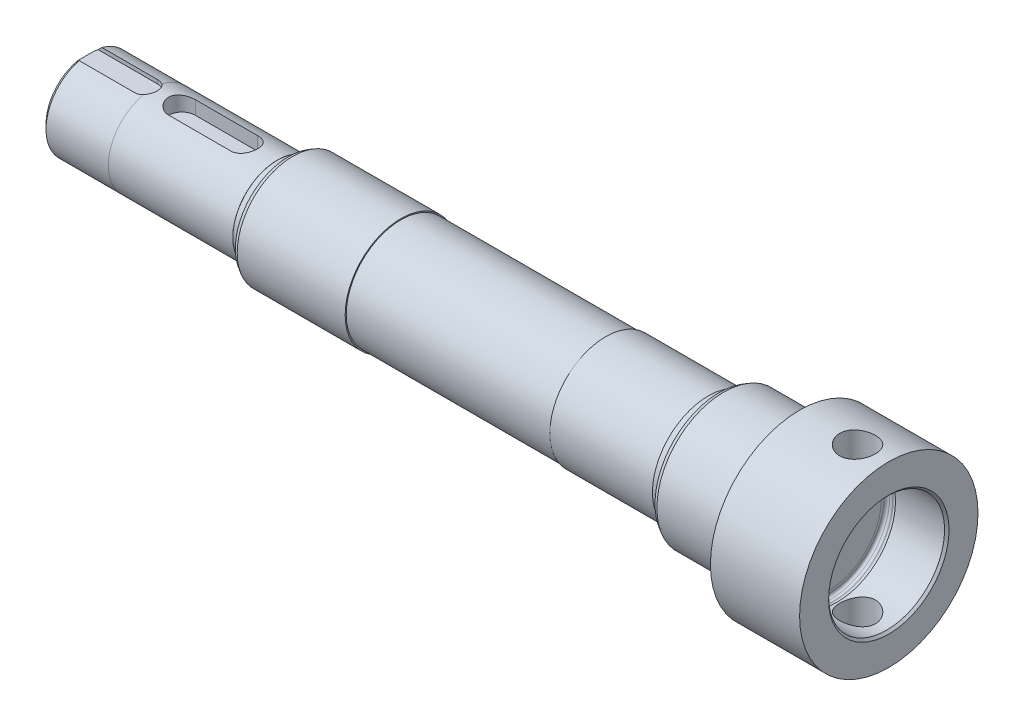
from build123d import *
from OCP.BRepFilletAPI import BRepFilletAPI_MakeChamfer

# Parameters (mm, degrees)
FASE1_SIZE                      = 1
SKIZZE3_R                       = 4
SCHNITT_LINEAR_AUSTRAGEN2_DEPTH = 22.5
SCHNITT_LINEAR_AUSTRAGEN3_DEPTH = 3.5
SCHNITT_LINEAR_AUSTRAGEN4_DEPTH = 1.2
FASE2_SIZE                      = 1
FASE2_SIZE2                     = 0.577350269
SCHNITT_F_T2_DEPTH              = 2
SCHNITT_F_T2_DEPTH_BACK         = 0.1
G_T1_R                          = 13.2
G_T1_R_2                        = 11.8
FASE_15_T1_SIZE2                = 0.746410162
FASE_15_T1_SIZE                 = 0.2
FASE_8_T2_SIZE                  = 0.711536972
FASE_8_T2_SIZE_2                = 0.1
RADIUS_R_R                      = 0.6
SCHNITT_F_T21_DEPTH             = 2.5
SCHNITT_F_T21_DEPTH_BACK        = 0.2
G_T11_R                         = 11.775
G_T11_R_2                       = 9.675
FASE_8_T21_SIZE2                = 1.423073944
FASE_8_T21_SIZE                 = 0.2
RADIUS_R1_R                     = 0.6
SCHNITT_F_T22_DEPTH             = 2.5
SCHNITT_F_T22_DEPTH_BACK        = 0.2
G_T12_R                         = 14.3
G_T12_R_2                       = 12.2
FASE_8_T22_SIZE                 = 1.423073944
FASE_8_T22_SIZE_2               = 0.2
RADIUS_R2_R                     = 0.6


with BuildPart() as part:
    # Skizze1 → Rotation1 (revolve)
    with BuildSketch(Plane.XY, mode=Mode.PRIVATE) as rotation1_sk:
        with BuildLine():
            Line((-180, 0), (-180, 9.975))
            Line((-180, 9.975), (-165, 9.975))
            Line((-165, 9.975), (-165, 10))
            Line((-165, 10), (-134.6, 10))
            Line((-134.6, 10), (-134.6, 12.5))
            Line((-134.6, 12.5), (-109.4, 12.5))
            Line((-109.4, 12.5), (-109.4, 12.25))
            Line((-109.4, 12.25), (-63.5, 12.25))
            Line((-63.5, 12.25), (-63.5, 12.5))
            Line((-63.5, 12.5), (-38, 12.5))
            Line((-38, 12.5), (-38, 15))
            Line((-38, 15), (-22.01, 15))
            Line((-22.01, 15), (-22.01, 14.99))
            Line((-22.01, 14.99), (-22, 14.99))
            Line((-22, 14.99), (-22, 15))
            ThreePointArc((-22, 15), (-20.585786438, 15.585786438), (-20, 17))
            Line((-20, 17), (-20, 20))
            Line((-20, 20), (0, 20))
            Line((0, 20), (0, 13.5))
            Line((0, 13.5), (-0.5, 13))
            Line((-0.5, 13), (-13.5, 13))
            Line((-13.5, 13), (-13.5, 0))
            Line((-13.5, 0), (-180, 0))
        make_face()
    revolve(rotation1_sk.sketch.rotate(Axis((-239.063776618, 0, 0), (1, 0, 0)), 90), axis=Axis((-239.063776618, 0, 0), (1, 0, 0)))

    # Fase1
    fase1_edges = [part.edges().sort_by_distance(p)[0] for p in [
        (-180, 0, -9.975),
    ]]
    chamfer(fase1_edges, length=FASE1_SIZE)

    # Skizze3 → Schnitt-Linear austragen2 (cut, symmetric)
    with BuildSketch(Plane(origin=(0, 0, 0), x_dir=(1, 0, 0), z_dir=(0, 1, 0))):
        with Locations(Location((-7, 0, 0), (0, 0, 270))):
            Circle(SKIZZE3_R)
    extrude(amount=SCHNITT_LINEAR_AUSTRAGEN2_DEPTH, both=True, mode=Mode.SUBTRACT)

    # Skizze6 → Schnitt-Linear austragen3 (cut)
    with BuildSketch(Plane(origin=(0, 10, 0), x_dir=(-1, 0, 0), z_dir=(0, 1, 0))):
        with BuildLine():
            Line((144.5, 3), (158.5, 3))
            ThreePointArc((158.5, 3), (161.5, 0), (158.5, -3))
            Line((158.5, -3), (144.5, -3))
            ThreePointArc((144.5, -3), (141.5, 0), (144.5, 3))
        make_face()
    extrude(amount=-SCHNITT_LINEAR_AUSTRAGEN3_DEPTH, mode=Mode.SUBTRACT)

    # Skizze7 → Schnitt-Linear austragen4 (cut)
    with BuildSketch(Plane(origin=(0, 10, 0), x_dir=(-1, 0, 0), z_dir=(0, 1, 0))):
        with BuildLine():
            Line((180, -2.55), (166.55, -2.55))
            ThreePointArc((166.55, -2.55), (164, 0), (166.55, 2.55))
            Line((166.55, 2.55), (180, 2.55))
            ThreePointArc((180, 2.55), (182.55, 0), (180, -2.55))
        make_face()
    extrude(amount=-SCHNITT_LINEAR_AUSTRAGEN4_DEPTH, mode=Mode.SUBTRACT)

    # Fase2: one chamfer whose edges measure the first distance from different faces: ONE call of the kernel's chamfer builder (chamfer() names one face for all edges)
    fase2_edges_1 = [part.edges().sort_by_distance(p)[0] for p in [
        (-134.6, 0, -12.5),
    ]]
    fase2_side_1 = [part.faces().sort_by_distance(p)[0] for p in [
        (-122, 0, -12.5),
    ]]
    fase2_edges_2 = [part.edges().sort_by_distance(p)[0] for p in [
        (-38, 0, -15),
    ]]
    fase2_side_2 = [part.faces().sort_by_distance(p)[0] for p in [
        (-30.005, 0, -15),
    ]]
    fase2 = BRepFilletAPI_MakeChamfer(part.part.solid().wrapped)
    for e in fase2_edges_1:
        fase2.Add(FASE2_SIZE, FASE2_SIZE2, e.wrapped, fase2_side_1[0].wrapped)  # the first distance lies on this face
    for e in fase2_edges_2:
        fase2.Add(FASE2_SIZE, FASE2_SIZE2, e.wrapped, fase2_side_2[0].wrapped)  # the first distance lies on this face
    add(Compound.cast(fase2.Shape()), mode=Mode.REPLACE)

    # Skizze31 → Schnitt-Rotation1 (revolve, cut)
    with BuildSketch(Plane(origin=(-180, 0, 0), x_dir=(0, 0, 1), z_dir=(0, -1, 0)), mode=Mode.PRIVATE) as schnitt_rotation1_sk:
        Polygon((0, -2.20043031), (0.5, -1.9), (0.5, -0.969948452), (1.06, 0), (0, 0), align=None)
    revolve(schnitt_rotation1_sk.sketch.rotate(Axis((-180, 0, 0), (1, 0, 0)), 90), axis=Axis((-180, 0, 0), (1, 0, 0)), mode=Mode.SUBTRACT)

    # Skizze32 → Schnitt-Rotation11 (revolve, cut)
    with BuildSketch(Plane(origin=(-13.5, 0, 0), x_dir=(0, 0, -1), z_dir=(0, -1, 0)), mode=Mode.PRIVATE) as schnitt_rotation11_sk:
        Polygon((0, -2.20043031), (0.5, -1.9), (0.5, -0.969948452), (1.06, 0), (0, 0), align=None)
    revolve(schnitt_rotation11_sk.sketch.rotate(Axis((-13.5, 0, 0), (-1, 0, 0)), 270), axis=Axis((-13.5, 0, 0), (-1, 0, 0)), mode=Mode.SUBTRACT)

    # g+t1 → Schnitt f+t2 (cut, two sides: drawn at the far end of the back side and taken through both)
    with BuildSketch(Plane(origin=(-13.5, -18.258316634, 5.175605519), x_dir=(0, 0, -1), z_dir=(1, 0, 0)).offset(-SCHNITT_F_T2_DEPTH_BACK)):
        with Locations((5.175605519, 18.258316634)):
            Circle(G_T1_R)
        with Locations(Location((5.175605519, 18.258316634, 0), (0, 0, 180))):
            Circle(G_T1_R_2, mode=Mode.SUBTRACT)
    extrude(amount=SCHNITT_F_T2_DEPTH + SCHNITT_F_T2_DEPTH_BACK, mode=Mode.SUBTRACT)

    # Fase 15° t1
    fase_15_t1_edges = [part.edges().sort_by_distance(p)[0] for p in [
        (-11.5, 0, 13.2),
    ]]
    fase_15_t1_side = [part.faces().sort_by_distance(p)[0] for p in [
        (-11.5, 0, 13.196),
    ]]
    chamfer(fase_15_t1_edges, length=FASE_15_T1_SIZE - 0.0001, length2=FASE_15_T1_SIZE2 - 0.0001, reference=fase_15_t1_side[0])  # a hair under: the kernel refuses the full size

    # Fase 8° t2
    # the kernel refuses this chamfer: 0.711536972, 0.1 mm, written as the material it adds along each edge
    with BuildSketch(Plane(origin=(-13.6, 0, 0), x_dir=(0, 0, 1), z_dir=(0, 1, 0))) as fase_8_t2_piece_1:
        Polygon((11.8 + FASE_8_T2_SIZE, 0), (11.8, FASE_8_T2_SIZE_2), (11.8, 0), align=None)
    revolve(axis=Axis((-13.6, 0, 0), (1, 0, 0)))

    # Radius r
    radius_r_edges = [part.edges().sort_by_distance(p)[0] for p in [
        (-13.6, 0, 13.2),
        (-12.246310162, 0, 13.2),
    ]]
    fillet(radius_r_edges, radius=RADIUS_R_R)

    # g+t11 → Schnitt f+t21 (cut, two sides: drawn at the far end of the back side and taken through both)
    with BuildSketch(Plane(origin=(-134.6, 9.708864876, 5.574410301), x_dir=(0, 0, 1), z_dir=(-1, 0, 0)).offset(-SCHNITT_F_T21_DEPTH_BACK)):
        with Locations(Location((-5.574410301, -9.708864876, 0), (0, 0, 180))):
            Circle(G_T11_R)
        with Locations((-5.574410301, -9.708864876)):
            Circle(G_T11_R_2, mode=Mode.SUBTRACT)
    extrude(amount=SCHNITT_F_T21_DEPTH + SCHNITT_F_T21_DEPTH_BACK, mode=Mode.SUBTRACT)

    # Fase 15° t11: read off the stored shape, not the designer's step
    # Fase 15° t11 outline → Fase 15° t11 (revolve)
    with BuildSketch(Plane.YX):
        Polygon((9.975, -137.1), (9.675, -135.980384758), (9.675, -137.1), align=None)
    revolve(axis=Axis((0, 0, 0), (1, 0, 0)))

    # Fase 8° t21
    fase_8_t21_edges = [part.edges().sort_by_distance(p)[0] for p in [
        (-134.4, 0, 11.775),
    ]]
    fase_8_t21_side = [part.faces().sort_by_distance(p)[0] for p in [
        (-134.404, 0, 11.775),
    ]]
    chamfer(fase_8_t21_edges, length=FASE_8_T21_SIZE - 0.0001, length2=FASE_8_T21_SIZE2 - 0.0001, reference=fase_8_t21_side[0])  # a hair under: the kernel refuses the full size

    # Radius r1
    radius_r1_edges = [part.edges().sort_by_distance(p)[0] for p in [
        (-134.4, 0, -9.675),
        (-135.980384758, 6.841258108, 6.841258108),
    ]]
    fillet(radius_r1_edges, radius=RADIUS_R1_R)

    # g+t12 → Schnitt f+t22 (cut, two sides: drawn at the far end of the back side and taken through both)
    with BuildSketch(Plane(origin=(-38, 10.867060242, 7.130430604), x_dir=(0, 0, 1), z_dir=(-1, 0, 0)).offset(-SCHNITT_F_T22_DEPTH_BACK)):
        with Locations(Location((-7.130430604, -10.867060242, 0), (0, 0, 180))):
            Circle(G_T12_R)
        with Locations((-7.130430604, -10.867060242)):
            Circle(G_T12_R_2, mode=Mode.SUBTRACT)
    extrude(amount=SCHNITT_F_T22_DEPTH + SCHNITT_F_T22_DEPTH_BACK, mode=Mode.SUBTRACT)

    # Fase 15° t12: read off the stored shape, not the designer's step
    # Fase 15° t12 outline → Fase 15° t12 (revolve)
    with BuildSketch(Plane.YX):
        Polygon((12.5, -40.5), (12.2, -39.380384758), (12.2, -40.5), align=None)
    revolve(axis=Axis((0, 0, 0), (1, 0, 0)))

    # Fase 8° t22
    # the kernel refuses this chamfer: 1.423073944, 0.2 mm, written as the material it adds along each edge
    with BuildSketch(Plane(origin=(-37.8, 0, 0), x_dir=(0, 0, -1), z_dir=(0, 1, 0))) as fase_8_t22_piece_1:
        Polygon((14.3 - FASE_8_T22_SIZE, 0), (14.3, FASE_8_T22_SIZE_2), (14.3, 0), align=None)
    revolve(axis=Axis((-37.8, 0, 0), (-1, 0, 0)))

    # Radius r2
    radius_r2_edges = [part.edges().sort_by_distance(p)[0] for p in [
        (-37.8, 0, -12.2),
        (-39.380384758, -8.62670273, -8.62670273),
    ]]
    fillet(radius_r2_edges, radius=RADIUS_R2_R)


solid = part.part
